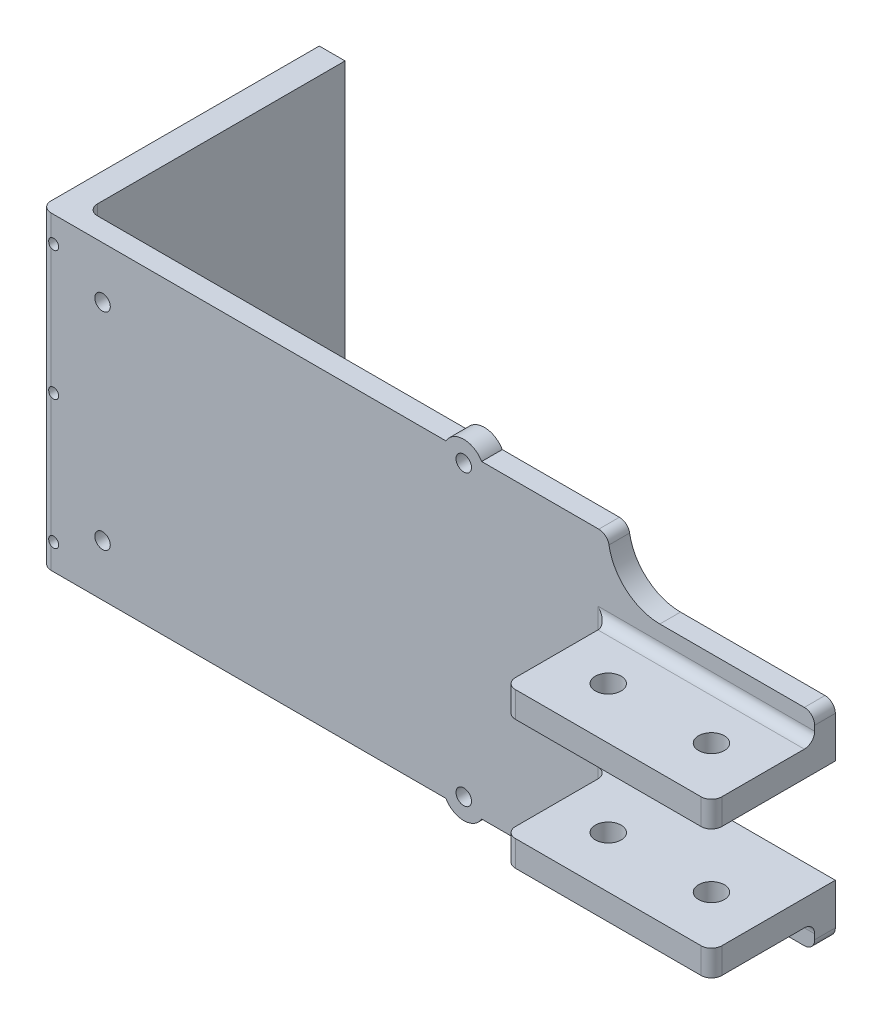
from build123d import *

# Parameters (mm, degrees)
SCHIZZO1_R                    = 1.5
SCHIZZO1_W                    = 40
SCHIZZO1_H                    = 10
ESTRUSIONE_ESTRUSIONE1_DEPTH  = 4
RACCORDO1_R                   = 10
SCHIZZO2_R                    = 4
SCHIZZO2_R_2                  = 2
ESTRUSIONE_ESTRUSIONE2_DEPTH  = 4
SCHIZZO3_W                    = 40
SCHIZZO3_H                    = 5
ESTRUSIONE_ESTRUSIONE3_DEPTH  = 20
TAGLIO_ESTRUSIONE1_DEPTH      = 90.673017123
TAGLIO_ESTRUSIONE1_DEPTH_BACK = 90.673017123
SCHIZZO4_R                    = 2.5
SCHIZZO5_W                    = 5
SCHIZZO5_H                    = 60
ESTRUSIONE_ESTRUSIONE4_DEPTH  = 54
SCHIZZO6_R                    = 1.5
ESTRUSIONE_ESTRUSIONE5_DEPTH  = 5
RACCORDO2_R                   = 2
SMUSSO1_SIZE                  = 1
SCHIZZO7_R                    = 1
TAGLIO_ESTRUSIONE2_DEPTH      = 10


with BuildPart() as part:
    # Schizzo1 → Estrusione-Estrusione1 (new body)
    # profile 1 of 5: a face of its own
    with BuildSketch(Plane.XY):
        with BuildLine():
            Line((32.5, -20), (32.5, -10))
            Line((32.5, -10), (32.5, 10))
            Line((32.5, 10), (32.5, 20))
            Line((32.5, 20), (-64, 20))
            ThreePointArc((-64, 20), (-65.5, 18.5), (-67, 20))
            Line((-67, 20), (-72.5, 20))
            Line((-72.5, 20), (-72.5, -20))
            Line((-72.5, -20), (-67, -20))
            ThreePointArc((-67, -20), (-65.5, -18.5), (-64, -20))
            Line((-64, -20), (32.5, -20))
        make_face()
    # profile 2 of 5: a face of its own
    with BuildSketch(Plane.XY):
        with BuildLine():
            Line((-64, 20), (32.5, 20))
            Line((32.5, 20), (32.5, 30))
            Line((32.5, 30), (-72.5, 30))
            Line((-72.5, 30), (-72.5, 20))
            Line((-72.5, 20), (-67, 20))
            ThreePointArc((-67, 20), (-65.5, 21.5), (-64, 20))
        make_face()
        with Locations((4.5, 28)):
            Circle(SCHIZZO1_R, mode=Mode.SUBTRACT)
    # profile 3 of 5: a face of its own
    with BuildSketch(Plane.XY):
        with BuildLine():
            Line((32.5, -30), (32.5, -20))
            Line((32.5, -20), (-64, -20))
            ThreePointArc((-64, -20), (-65.5, -21.5), (-67, -20))
            Line((-67, -20), (-72.5, -20))
            Line((-72.5, -20), (-72.5, -30))
            Line((-72.5, -30), (32.5, -30))
        make_face()
        with Locations((4.5, -28)):
            Circle(SCHIZZO1_R, mode=Mode.SUBTRACT)
    # profile 4 of 5: a face of its own
    with BuildSketch(Plane.XY):
        with Locations((52.5, 15)):
            Rectangle(SCHIZZO1_W, SCHIZZO1_H)
    # profile 5 of 5: a face of its own
    with BuildSketch(Plane.XY):
        with Locations((52.5, -15)):
            Rectangle(SCHIZZO1_W, SCHIZZO1_H)
    extrude(amount=ESTRUSIONE_ESTRUSIONE1_DEPTH)

    # Raccordo1
    raccordo1_edges = [part.edges().sort_by_distance(p)[0] for p in [
        (32.5, 20, 2),
        (32.5, -20, 2),
    ]]
    fillet(raccordo1_edges, radius=RACCORDO1_R - 0.0001)  # a hair under: the kernel refuses the full size

    # Schizzo2 → Estrusione-Estrusione2 (add)
    # profile 1 of 2: a face of its own
    with BuildSketch(Plane.XY.offset(4)):
        with Locations((4.5, -28)):
            Circle(SCHIZZO2_R)
        with Locations((4.5, -28)):
            Circle(SCHIZZO2_R_2, mode=Mode.SUBTRACT)
    # profile 2 of 2: a face of its own
    with BuildSketch(Plane.XY.offset(4)):
        with Locations((4.5, 28)):
            Circle(SCHIZZO2_R)
        with Locations((4.5, 28)):
            Circle(SCHIZZO2_R_2, mode=Mode.SUBTRACT)
    extrude(amount=-ESTRUSIONE_ESTRUSIONE2_DEPTH)

    # Schizzo3 → Estrusione-Estrusione3 (add)
    with BuildSketch(Plane.XY.offset(4)):
        with Locations((52.5, -12.5)):
            Rectangle(SCHIZZO3_W, SCHIZZO3_H)
        with Locations((52.5, 12.5)):
            Rectangle(SCHIZZO3_W, SCHIZZO3_H)
    extrude(amount=ESTRUSIONE_ESTRUSIONE3_DEPTH)

    # Schizzo4 → Taglio-Estrusione1 (cut, two sides: drawn at the far end of the back side and taken through both)
    with BuildSketch(Plane.XZ.offset(15).offset(-TAGLIO_ESTRUSIONE1_DEPTH_BACK)):
        with Locations(Location((42.5, 14, 0), (0, 0, 270))):
            Circle(SCHIZZO4_R)
        with Locations(Location((62.5, 14, 0), (0, 0, 270))):
            Circle(SCHIZZO4_R)
    extrude(amount=TAGLIO_ESTRUSIONE1_DEPTH + TAGLIO_ESTRUSIONE1_DEPTH_BACK, mode=Mode.SUBTRACT)

    # Schizzo5 → Estrusione-Estrusione4 (add)
    with BuildSketch(Plane.XY.offset(4)):
        with Locations((-75, 0)):
            Rectangle(SCHIZZO5_W, SCHIZZO5_H)
    extrude(amount=-ESTRUSIONE_ESTRUSIONE4_DEPTH)

    # Schizzo6 → Estrusione-Estrusione5 (add)
    with BuildSketch(Plane(origin=(0, 0, -50), x_dir=(-1, 0, 0), z_dir=(0, 0, -1))):
        Polygon((87.5, 20), (77.5, 30), (77.5, -30), (87.5, -20), align=None)
        with Locations((82.065858054, -15)):
            Circle(SCHIZZO6_R, mode=Mode.SUBTRACT)
        with Locations((82.065858054, 15)):
            Circle(SCHIZZO6_R, mode=Mode.SUBTRACT)
    extrude(amount=-ESTRUSIONE_ESTRUSIONE5_DEPTH)

    # Raccordo2
    raccordo2_edges = [part.edges().sort_by_distance(p)[0] for p in [
        (32.5, -12.5, 4),
        (52.5, -15, 4),
        (72.5, -12.5, 24),
        (32.5, -12.5, 24),
        (52.5, 15, 4),
        (32.5, 12.5, 4),
        (32.5, 12.5, 24),
        (72.5, 12.5, 24),
        (-77.5, 0, 4),
        (-87.5, 20, -47.5),
        (-87.5, -20, -47.5),
        (-72.5, 0, 0),
        (72.5, 20, 2),
        (72.5, -20, 2),
        (32.5, -30, 2),
        (32.5, 30, 2),
    ]]
    fillet(raccordo2_edges, radius=RACCORDO2_R)

    # Smusso1
    smusso1_edges = [part.edges().sort_by_distance(p)[0] for p in [
        (3, 28, 0),
        (3, -28, 0),
        (-67, 20, 0),
        (-64, -20, 0),
    ]]
    chamfer(smusso1_edges, length=SMUSSO1_SIZE)

    # Schizzo7 → Taglio-Estrusione2 (cut)
    with BuildSketch(Plane.XY.offset(4)):
        with Locations((-75, 0)):
            Circle(SCHIZZO7_R)
        with Locations((-75, 25)):
            Circle(SCHIZZO7_R)
        with Locations((-75, -25)):
            Circle(SCHIZZO7_R)
    extrude(amount=-TAGLIO_ESTRUSIONE2_DEPTH, mode=Mode.SUBTRACT)


solid = part.part
